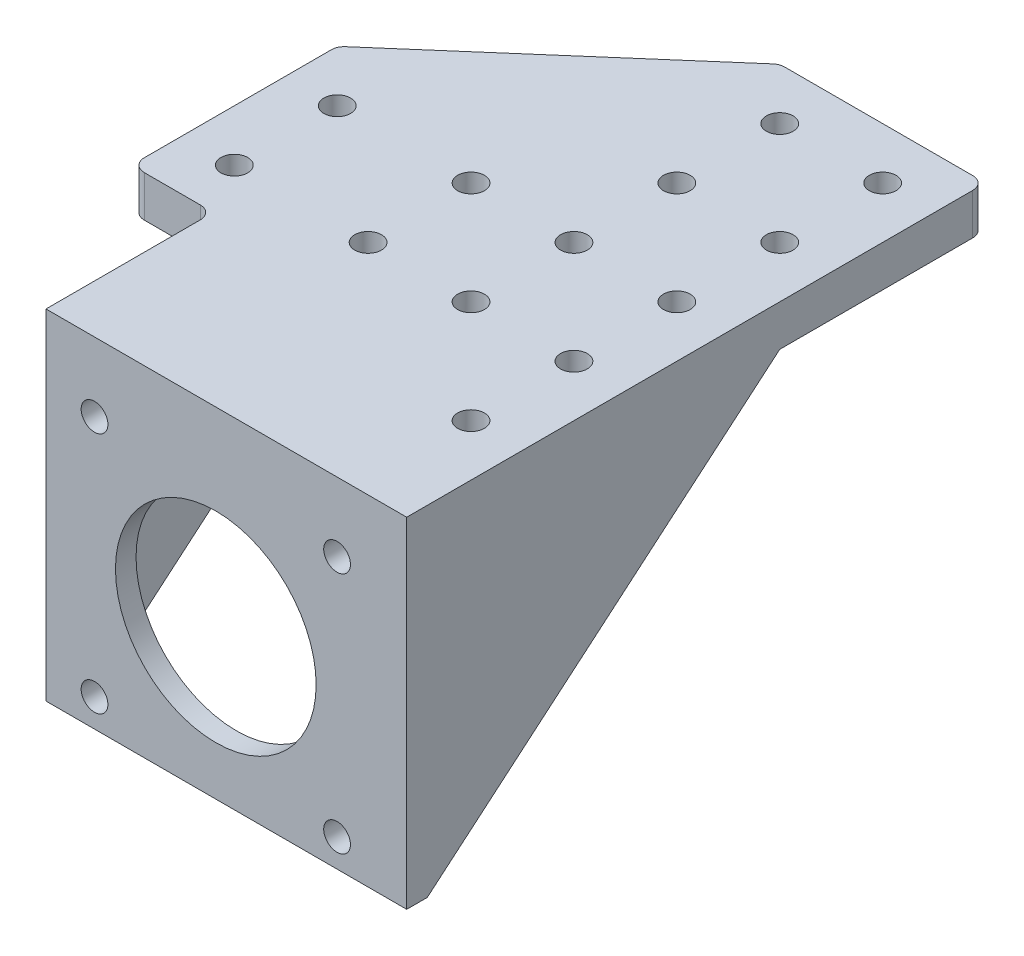
from build123d import *

# Parameters (mm, degrees)
EXTRUDE_1_DEPTH     = 4
SKETCH_6_R          = 19.5
SKETCH_6_R_2        = 2.6
CUT_EXTRUDE_1_DEPTH = 45.18834688
EXTRUDE_2_DEPTH     = 8
EXTRUDE_3_DEPTH     = 4
EXTRUDE_4_DEPTH     = 4
SKETCH_8_R          = 2.6
CUT_EXTRUDE_2_DEPTH = 137.086222668
SKETCH_12_R         = 5
CUT_EXTRUDE_3_DEPTH = 3
SKETCH_13_R         = 5
CUT_EXTRUDE_4_DEPTH = 0.2
FILLET_1_R          = 2.5
CHAMFER_2_SIZE      = 3


with BuildPart() as part:
    # Эскиз1 → Бобышка-Вытянуть1 (new body)
    with BuildSketch(Plane.XY):
        Polygon((-29, 29), (29, 29), (33.1, 29), (33.1, -29), (29, -29), (-29, -29), align=None)
    extrude(amount=EXTRUDE_1_DEPTH)

    # Эскиз6 → Вырез-Вытянуть1 (cut, through all)
    with BuildSketch(Plane.XY.offset(4)):
        Circle(SKETCH_6_R)
        with Locations((-23.57, 23.57)):
            Circle(SKETCH_6_R_2)
        with Locations((23.57, 23.57)):
            Circle(SKETCH_6_R_2)
        with Locations((-23.57, -23.57)):
            Circle(SKETCH_6_R_2)
        with Locations((23.57, -23.57)):
            Circle(SKETCH_6_R_2)
    extrude(amount=-CUT_EXTRUDE_1_DEPTH, mode=Mode.SUBTRACT)

    # Эскиз3 → Бобышка-Вытянуть2 (add)
    with BuildSketch(Plane(origin=(0, 29, 0), x_dir=(1, 0, 0), z_dir=(0, 1, 0))):
        Polygon((-29, -4), (37.1, -4), (37.1, 108.5), (-2.9, 108.5), (-48.9, 68.5), (-48.9, 28.5), (-29, 28.5), align=None)
    extrude(amount=EXTRUDE_2_DEPTH)

    # Эскиз5 → Бобышка-Вытянуть3 (add)
    with BuildSketch(Plane(origin=(33.1, 0, 0), x_dir=(0, 0, -1), z_dir=(1, 0, 0))):
        Polygon((-4, -29), (-4, 37), (68.5, 37), (68.5, 29), (0, -29), align=None)
    extrude(amount=EXTRUDE_3_DEPTH)

    # Эскиз10 → Бобышка-Вытянуть4 (add)
    with BuildSketch(Plane.ZY.offset(29)):
        Polygon((4, -29), (0, -29), (-68.5, 29), (-68.5, 37), (4, 37), align=None)
    extrude(amount=EXTRUDE_4_DEPTH)

    # Эскиз8 → Вырез-Вытянуть2 (cut, through all)
    with BuildSketch(Plane(origin=(0, 37, 0), x_dir=(1, 0, 0), z_dir=(0, 1, 0))):
        with Locations(Location((27.1, 38.5, 0), (0, 0, 270))):
            Circle(SKETCH_8_R)
        with Locations(Location((7.1, 38.5, 0), (0, 0, 270))):
            Circle(SKETCH_8_R)
        with Locations(Location((7.1, 58.5, 0), (0, 0, 270))):
            Circle(SKETCH_8_R)
        with Locations(Location((7.1, 78.5, 0), (0, 0, 270))):
            Circle(SKETCH_8_R)
        with Locations(Location((7.1, 98.5, 0), (0, 0, 270))):
            Circle(SKETCH_8_R)
        with Locations(Location((27.1, 58.5, 0), (0, 0, 270))):
            Circle(SKETCH_8_R)
        with Locations(Location((27.1, 78.5, 0), (0, 0, 270))):
            Circle(SKETCH_8_R)
        with Locations(Location((27.1, 98.5, 0), (0, 0, 270))):
            Circle(SKETCH_8_R)
        with Locations(Location((-12.9, 58.5, 0), (0, 0, 270))):
            Circle(SKETCH_8_R)
        with Locations(Location((-12.9, 38.5, 0), (0, 0, 270))):
            Circle(SKETCH_8_R)
        with Locations(Location((-38.9, 58.5, 0), (0, 0, 270))):
            Circle(SKETCH_8_R)
        with Locations(Location((-38.9, 38.5, 0), (0, 0, 270))):
            Circle(SKETCH_8_R)
        with Locations(Location((27.1, 18.5, 0), (0, 0, 270))):
            Circle(SKETCH_8_R)
    extrude(amount=-CUT_EXTRUDE_2_DEPTH, mode=Mode.SUBTRACT)

    # Эскиз12 → Вырез-Вытянуть3 (cut)
    with BuildSketch(Plane.XZ.offset(-29)):
        with Locations(Location((27.1, -38.5, 0), (0, 0, 270))):
            Circle(SKETCH_12_R)
        with Locations(Location((7.1, -38.5, 0), (0, 0, 270))):
            Circle(SKETCH_12_R)
        with Locations(Location((-12.9, -38.5, 0), (0, 0, 270))):
            Circle(SKETCH_12_R)
        with Locations(Location((7.1, -58.5, 0), (0, 0, 270))):
            Circle(SKETCH_12_R)
        with Locations(Location((-12.9, -58.5, 0), (0, 0, 270))):
            Circle(SKETCH_12_R)
        with Locations(Location((27.1, -58.5, 0), (0, 0, 270))):
            Circle(SKETCH_12_R)
        with Locations(Location((27.1, -18.5, 0), (0, 0, 270))):
            Circle(SKETCH_12_R)
    extrude(amount=-CUT_EXTRUDE_3_DEPTH, mode=Mode.SUBTRACT)

    # Эскиз13 → Вырез-Вытянуть4 (cut)
    with BuildSketch(Plane.XZ.offset(-29)):
        with Locations(Location((-38.9, -38.5, 0), (0, 0, 270))):
            Circle(SKETCH_13_R)
        with Locations(Location((-38.9, -58.5, 0), (0, 0, 270))):
            Circle(SKETCH_13_R)
        with Locations(Location((27.1, -78.5, 0), (0, 0, 270))):
            Circle(SKETCH_13_R)
        with Locations(Location((7.1, -78.5, 0), (0, 0, 270))):
            Circle(SKETCH_13_R)
        with Locations(Location((7.1, -98.5, 0), (0, 0, 270))):
            Circle(SKETCH_13_R)
        with Locations(Location((27.1, -98.5, 0), (0, 0, 270))):
            Circle(SKETCH_13_R)
    extrude(amount=-CUT_EXTRUDE_4_DEPTH, mode=Mode.SUBTRACT)

    # Скругление1
    fillet_1_edges = [part.edges().sort_by_distance(p)[0] for p in [
        (37.1, 33, -108.5),
        (-2.9, 33, -108.5),
        (-48.9, 33, -68.5),
        (-48.9, 33, -28.5),
        (-33, 33, -28.5),
    ]]
    fillet(fillet_1_edges, radius=FILLET_1_R)

    # Фаска2
    # the kernel refuses this chamfer: 3 mm, written as the material it adds along each edge
    with BuildSketch(Plane(origin=(-29, 29, 0), x_dir=(-0.027495876610586768, -0.9996219169112968, 0), z_dir=(0, 0, -1))) as chamfer_2_piece_1_section:
        Polygon((CHAMFER_2_SIZE * 0.999621916911, -CHAMFER_2_SIZE * 0.0274958766106), (-CHAMFER_2_SIZE * 0.0274958766106, -CHAMFER_2_SIZE * 0.999621916911), (0, 0), align=None)
    chamfer_2_piece_1 = extrude(amount=76.215048964, mode=Mode.PRIVATE)
    chamfer_2_piece_1 = split(chamfer_2_piece_1, bisect_by=Plane(origin=(-27.995614035, 11.406791474, -47.721814069), z_dir=(0, 0.7631749451448332, 0.6461919243562093)), keep=Keep.TOP, mode=Mode.PRIVATE)
    add(chamfer_2_piece_1)
    with BuildSketch(Plane(origin=(33.1, 29, -76.215048964), x_dir=(0.027495876610586768, -0.9996219169112968, 0), z_dir=(0, 0, 1))) as chamfer_2_piece_2_section:
        Polygon((CHAMFER_2_SIZE * 0.999621916911, -CHAMFER_2_SIZE * 0.0274958766106), (-CHAMFER_2_SIZE * 0.0274958766106, -CHAMFER_2_SIZE * 0.999621916911), (0, 0), align=None)
    chamfer_2_piece_2 = extrude(amount=76.215048964, mode=Mode.PRIVATE)
    chamfer_2_piece_2 = chamfer_2_piece_2 - Plane(origin=(27.1, 27.967688512, -58.5), x_dir=(0, 0, -1), z_dir=(0, -1, 0)) * Cylinder(5, 165, mode=Mode.PRIVATE)
    chamfer_2_piece_2 = chamfer_2_piece_2 - Plane(origin=(27.1, 27.967688512, -38.5), x_dir=(0, 0, -1), z_dir=(0, -1, 0)) * Cylinder(5, 165, mode=Mode.PRIVATE)
    chamfer_2_piece_2 = chamfer_2_piece_2 - Plane(origin=(27.1, 27.967688512, -18.5), x_dir=(0, 0, -1), z_dir=(0, -1, 0)) * Cylinder(5, 165, mode=Mode.PRIVATE)
    chamfer_2_piece_2 = split(chamfer_2_piece_2, bisect_by=Plane(origin=(32.179087154, 11.152901074, -47.421960751), z_dir=(0, 0.7631749451448332, 0.6461919243562093)), keep=Keep.TOP, mode=Mode.PRIVATE)
    add(chamfer_2_piece_2)


solid = part.part
